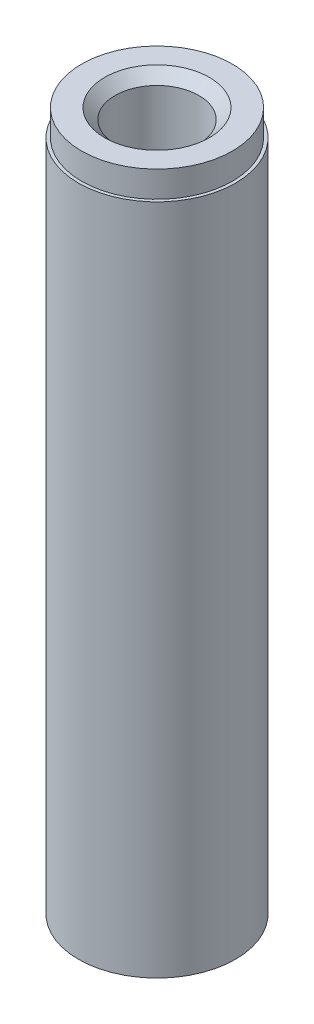
from build123d import *

# Parameters (mm, degrees)
SKETCH1_R           = 37.5
SKETCH1_R_2         = 20
BOSS_EXTRUDE1_DEPTH = 333.5
SKETCH2_R           = 57.290073323
SKETCH2_R_2         = 36
CUT_EXTRUDE1_DEPTH  = 12.5
CHAMFER2_SIZE       = 5


with BuildPart() as part:
    # Sketch1 → Boss-Extrude1 (new body)
    with BuildSketch(Plane(origin=(0, 0, 0), x_dir=(1, 0, 0), z_dir=(0, 1, 0))):
        Circle(SKETCH1_R)
        Circle(SKETCH1_R_2, mode=Mode.SUBTRACT)
    extrude(amount=BOSS_EXTRUDE1_DEPTH)

    # Sketch2 → Cut-Extrude1 (cut)
    with BuildSketch(Plane(origin=(0, 333.5, 0), x_dir=(1, 0, 0), z_dir=(0, 1, 0))):
        Circle(SKETCH2_R)
        Circle(SKETCH2_R_2, mode=Mode.SUBTRACT)
    extrude(amount=-CUT_EXTRUDE1_DEPTH, mode=Mode.SUBTRACT)

    # Chamfer2
    chamfer2_edges = [part.edges().sort_by_distance(p)[0] for p in [
        (-20, 333.5, 0),
    ]]
    chamfer(chamfer2_edges, length=CHAMFER2_SIZE)


solid = part.part
